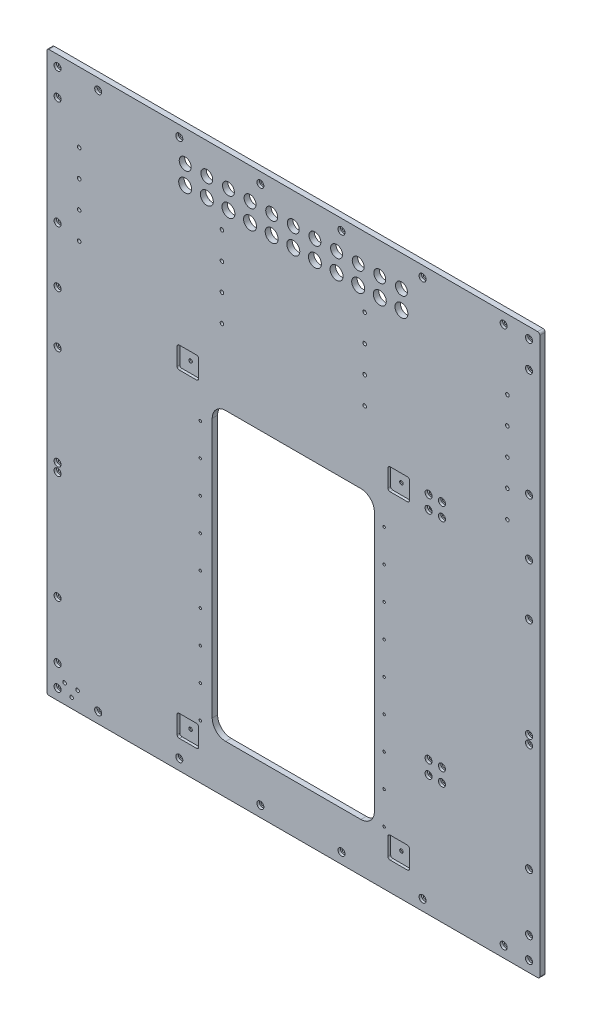
from build123d import *

# Parameters (mm, degrees)
BOSS_EXTRU_1_DEPTH                            = 10
ENL_V_MAT_EXTRU_1_DEPTH                       = 690.813199352
D_GAGEMENT_M41_D                              = 4.5
R_P_TITION_LIN_AIRE8_COUNT                    = 9
R_P_TITION_LIN_AIRE8_PITCH                    = 60
R_P_TITION_LIN_AIRE8_COUNT_DIR2               = 2
R_P_TITION_LIN_AIRE8_PITCH_DIR2               = 340
D_GAGEMENT_M65_D                              = 6.6
R_P_TITION_LIN_AIRE9_COUNT                    = 2
R_P_TITION_LIN_AIRE9_PITCH                    = 872
R_P_TITION_LIN_AIRE10_COUNT                   = 6
R_P_TITION_LIN_AIRE10_PITCH                   = 150
R_P_TITION_LIN_AIRE11_COUNT                   = 5
R_P_TITION_LIN_AIRE11_PITCH                   = 200
R_P_TITION_LIN_AIRE11_COUNT_DIR2              = 2
R_P_TITION_LIN_AIRE11_PITCH_DIR2              = 872
CHAMBRAGE_POUR_VIS_T_TE_RONDE_BOMB_4_A_COUNT  = 2
CHAMBRAGE_POUR_VIS_T_TE_RONDE_BOMB_4_A_PITCH  = 40
R_P_TITION_LIN_AIRE13_COUNT                   = 2
R_P_TITION_LIN_AIRE13_PITCH                   = 872
R_P_TITION_LIN_AIRE14_COUNT                   = 6
R_P_TITION_LIN_AIRE14_PITCH                   = 150
ESQUISSE41_R                                  = 1.5
ENL_V_MAT_EXTRU_2_DEPTH                       = 690.813199352
CHAMBRAGE_POUR_VIS_T_TE_RONDE_BOMB_6_A_COUNT  = 2
CHAMBRAGE_POUR_VIS_T_TE_RONDE_BOMB_6_A_PITCH  = 281
CHAMBRAGE_POUR_VIS_T_TE_RONDE_BOMB_7_COUNT    = 2
CHAMBRAGE_POUR_VIS_T_TE_RONDE_BOMB_7_PITCH    = 916.15773751
CHAMBRAGE_POUR_VIS_T_TE_RONDE_BOMB_8_COUNT    = 2
CHAMBRAGE_POUR_VIS_T_TE_RONDE_BOMB_8_PITCH    = 872
D_GAGEMENT_M67_D                              = 6.6
R_P_TITION_LIN_AIRE15_COUNT                   = 4
R_P_TITION_LIN_AIRE15_PITCH                   = 264
R_P_TITION_LIN_AIRE15_COUNT_DIR2              = 5
R_P_TITION_LIN_AIRE15_PITCH_DIR2              = 50
D_GAGEMENT_M68_D                              = 6.6
R_P_TITION_LIN_AIRE16_COUNT                   = 2
R_P_TITION_LIN_AIRE16_PITCH                   = 390
R_P_TITION_LIN_AIRE16_COUNT_DIR2              = 2
R_P_TITION_LIN_AIRE16_PITCH_DIR2              = 590
ENL_V_MAT_EXTRU_6_DEPTH                       = 5
R_P_TITION_LIN_AIRE18_COUNT                   = 2
R_P_TITION_LIN_AIRE18_PITCH                   = 590
R_P_TITION_LIN_AIRE18_COUNT_DIR2              = 2
R_P_TITION_LIN_AIRE18_PITCH_DIR2              = 390
ENL_V_MAT_EXTRU_9_DEPTH                       = 5
R_P_TITION_LIN_AIRE20_COUNT                   = 2
R_P_TITION_LIN_AIRE20_PITCH                   = 425
M6_CLEARANCE_HOLE1_D                          = 6.6
CBORE_FOR_M6_PAN_HEAD_MACHINE_SCREW2_AT_COUNT = 2
CBORE_FOR_M6_PAN_HEAD_MACHINE_SCREW2_AT_PITCH = 24.748737342
CBORE_FOR_M6_PAN_HEAD_MACHINE_SCREW2_2_COUNT  = 2
CBORE_FOR_M6_PAN_HEAD_MACHINE_SCREW2_2_PITCH  = 35
CBORE_FOR_M6_PAN_HEAD_MACHINE_SCREW2_3_COUNT  = 2
CBORE_FOR_M6_PAN_HEAD_MACHINE_SCREW2_3_PITCH  = 24.748737342
LPATTERN2_COUNT                               = 2
LPATTERN2_PITCH                               = 425
CBORE_FOR_M6_PAN_HEAD_MACHINE_SCREW3_AT_COUNT = 2
CBORE_FOR_M6_PAN_HEAD_MACHINE_SCREW3_AT_PITCH = 390
CBORE_FOR_M6_PAN_HEAD_MACHINE_SCREW3_2_COUNT  = 2
CBORE_FOR_M6_PAN_HEAD_MACHINE_SCREW3_2_PITCH  = 707.248188403
CBORE_FOR_M6_PAN_HEAD_MACHINE_SCREW3_3_COUNT  = 2
CBORE_FOR_M6_PAN_HEAD_MACHINE_SCREW3_3_PITCH  = 590
SKETCH11_R                                    = 3
CUT_EXTRUDE1_DEPTH                            = 10
M20_CLEARANCE_HOLE1_D                         = 22
M22_CLEARANCE_HOLE1_D                         = 24
LPATTERN3_COUNT                               = 6
LPATTERN3_PITCH                               = 40
LPATTERN4_COUNT                               = 6
LPATTERN4_PITCH                               = 40
M6_CLEARANCE_HOLE2_D                          = 6.6


with BuildPart() as part:
    # Esquisse1 → Boss.-Extru.1 (new body)
    with BuildSketch(Plane.XY):
        with BuildLine():
            Line((-452, -517.5), (452, -517.5))
            ThreePointArc((452, -517.5), (454.828427125, -516.328427125), (456, -513.5))
            Line((456, -513.5), (456, 513.5))
            ThreePointArc((456, 513.5), (454.828427125, 516.328427125), (452, 517.5))
            Line((452, 517.5), (-452, 517.5))
            ThreePointArc((-452, 517.5), (-454.828427125, 516.328427125), (-456, 513.5))
            Line((-456, 513.5), (-456, -513.5))
            ThreePointArc((-456, -513.5), (-454.828427125, -516.328427125), (-452, -517.5))
        make_face()
    extrude(amount=BOSS_EXTRU_1_DEPTH)

    # Esquisse2 → Enlèv. mat.-Extru.1 (cut, through all)
    with BuildSketch(Plane.XY.offset(10)):
        with BuildLine():
            Line((-125, -427.5), (125, -427.5))
            ThreePointArc((125, -427.5), (142.67766953, -420.17766953), (150, -402.5))
            Line((150, -402.5), (150, 77.5))
            ThreePointArc((150, 77.5), (142.67766953, 95.17766953), (125, 102.5))
            Line((125, 102.5), (-125, 102.5))
            ThreePointArc((-125, 102.5), (-142.67766953, 95.17766953), (-150, 77.5))
            Line((-150, 77.5), (-150, -402.5))
            ThreePointArc((-150, -402.5), (-142.67766953, -420.17766953), (-125, -427.5))
        make_face()
    extrude(amount=-ENL_V_MAT_EXTRU_1_DEPTH, mode=Mode.SUBTRACT)

    # Dégagement M41 (through all)
    with Locations(Plane.XY.offset(10)):
        with Locations((-172, -417.5)):
            d_gagement_m41 = Hole(D_GAGEMENT_M41_D / 2)

    # Répétition linéaire8: D_gagement M41 9 × 2
    with Locations(*[(j * R_P_TITION_LIN_AIRE8_PITCH_DIR2, i * R_P_TITION_LIN_AIRE8_PITCH, 0) for i in range(R_P_TITION_LIN_AIRE8_COUNT) for j in range(R_P_TITION_LIN_AIRE8_COUNT_DIR2) if (i, j) != (0, 0)]):
        add(d_gagement_m41, mode=Mode.SUBTRACT)

    # Dégagement M65 (through all)
    with Locations(Plane(origin=(0, 0, 0), x_dir=(-1, 0, 0), z_dir=(0, 0, -1))):
        with Locations((-436.000000001, 497.5), (-436.000000001, 448.286376646), (-389.123182304, 497.5), (-436.000000001, -457.5), (-436.000000001, -497.5), (-389.123182304, -497.5), (435.999999999, -457.5), (435.999999999, -497.5)):
            Hole(D_GAGEMENT_M65_D / 2)

    # Esquisse27 → Chambrage pour vis _ t_te ronde bomb_e M (revolve, cut)
    with BuildSketch(Plane(origin=(436.000000001, 497.5, 10), x_dir=(0, -1, 0), z_dir=(1, 0, 0))):
        Polygon((0, 0), (0, 10), (3.3, 10), (3.3, 4.625), (3.325, 4.6), (6.5, 4.6), (6.5, 0), align=None)
    chambrage_pour_vis_t_te_ronde_bomb_e_m = revolve(axis=Axis((436.000000001, 497.5, 16.35), (0, 0, -1)), mode=Mode.SUBTRACT)

    # Répétition linéaire9: Chambrage pour vis _ t_te ronde bomb_e M ×2
    with Locations(*[(-i * R_P_TITION_LIN_AIRE9_PITCH, 0, 0) for i in range(1, R_P_TITION_LIN_AIRE9_COUNT)]):
        add(chambrage_pour_vis_t_te_ronde_bomb_e_m, mode=Mode.SUBTRACT)

    # Esquisse29 → Chambrage pour vis _ t_te ronde bomb 2 (revolve, cut)
    with BuildSketch(Plane(origin=(389.123182304, 497.5, 10), x_dir=(0, -1, 0), z_dir=(1, 0, 0))):
        Polygon((0, 0), (0, 10), (3.3, 10), (3.3, 4.625), (3.325, 4.6), (6.5, 4.6), (6.5, 0), align=None)
    chambrage_pour_vis_t_te_ronde_bomb_2 = revolve(axis=Axis((389.123182304, 497.5, 16.35), (0, 0, -1)), mode=Mode.SUBTRACT)

    # Répétition linéaire10: Chambrage pour vis _ t_te ronde bomb 2 ×6
    with Locations(*[(-i * R_P_TITION_LIN_AIRE10_PITCH, 0, 0) for i in range(1, R_P_TITION_LIN_AIRE10_COUNT)]):
        add(chambrage_pour_vis_t_te_ronde_bomb_2, mode=Mode.SUBTRACT)

    # Esquisse31 → Chambrage pour vis _ t_te ronde bomb 3 (revolve, cut)
    with BuildSketch(Plane(origin=(436.000000001, 448.286376646, 10), x_dir=(0, -1, 0), z_dir=(1, 0, 0))):
        Polygon((0, 0), (0, 10), (3.3, 10), (3.3, 4.625), (3.325, 4.6), (6.5, 4.6), (6.5, 0), align=None)
    chambrage_pour_vis_t_te_ronde_bomb_3 = revolve(axis=Axis((436.000000001, 448.286376646, 16.35), (0, 0, -1)), mode=Mode.SUBTRACT)

    # Répétition linéaire11: Chambrage pour vis _ t_te ronde bomb 3 5 × 2
    with Locations(*[(-j * R_P_TITION_LIN_AIRE11_PITCH_DIR2, -i * R_P_TITION_LIN_AIRE11_PITCH, 0) for i in range(R_P_TITION_LIN_AIRE11_COUNT) for j in range(R_P_TITION_LIN_AIRE11_COUNT_DIR2) if (i, j) != (0, 0)]):
        add(chambrage_pour_vis_t_te_ronde_bomb_3, mode=Mode.SUBTRACT)

    # Esquisse33 → Chambrage pour vis _ t_te ronde bomb 4 (revolve, cut)
    with BuildSketch(Plane(origin=(436.000000001, -457.5, 10), x_dir=(0, -1, 0), z_dir=(1, 0, 0))):
        Polygon((0, 0), (0, 10), (3.3, 10), (3.3, 4.625), (3.325, 4.6), (6.5, 4.6), (6.5, 0), align=None)
    chambrage_pour_vis_t_te_ronde_bomb_4 = revolve(axis=Axis((436.000000001, -457.5, 16.35), (0, 0, -1)), mode=Mode.SUBTRACT)

    # Chambrage pour vis _ t_te ronde bomb 4 a: Chambrage pour vis _ t_te ronde bomb 4 ×2
    with Locations(*[(0, -i * CHAMBRAGE_POUR_VIS_T_TE_RONDE_BOMB_4_A_PITCH, 0) for i in range(1, CHAMBRAGE_POUR_VIS_T_TE_RONDE_BOMB_4_A_COUNT)]):
        add(chambrage_pour_vis_t_te_ronde_bomb_4, mode=Mode.SUBTRACT)

    # Répétition linéaire13: Chambrage pour vis _ t_te ronde bomb 4 ×2
    with Locations(*[(-i * R_P_TITION_LIN_AIRE13_PITCH, 0, 0) for i in range(1, R_P_TITION_LIN_AIRE13_COUNT)]):
        add(chambrage_pour_vis_t_te_ronde_bomb_4, mode=Mode.SUBTRACT)

    # Répétition linéaire13 copy 1 sketch → Répétition linéaire13 copy 1 (revolve, cut)
    with BuildSketch(Plane(origin=(-435.999999999, -497.5, 10), x_dir=(0, -1, 0), z_dir=(1, 0, 0))):
        Polygon((0, 0), (0, 10), (3.3, 10), (3.3, 4.625), (3.325, 4.6), (6.5, 4.6), (6.5, 0), align=None)
    revolve(axis=Axis((-435.999999999, -497.5, 16.35), (0, 0, -1)), mode=Mode.SUBTRACT)

    # Esquisse35 → Chambrage pour vis _ t_te ronde bomb 5 (revolve, cut)
    with BuildSketch(Plane(origin=(389.123182304, -497.5, 10), x_dir=(0, -1, 0), z_dir=(1, 0, 0))):
        Polygon((0, 0), (0, 10), (3.3, 10), (3.3, 4.625), (3.325, 4.6), (6.5, 4.6), (6.5, 0), align=None)
    chambrage_pour_vis_t_te_ronde_bomb_5 = revolve(axis=Axis((389.123182304, -497.5, 16.35), (0, 0, -1)), mode=Mode.SUBTRACT)

    # Répétition linéaire14: Chambrage pour vis _ t_te ronde bomb 5 ×6
    with Locations(*[(-i * R_P_TITION_LIN_AIRE14_PITCH, 0, 0) for i in range(1, R_P_TITION_LIN_AIRE14_COUNT)]):
        add(chambrage_pour_vis_t_te_ronde_bomb_5, mode=Mode.SUBTRACT)

    # Esquisse41 → Enlèv. mat.-Extru.2 (cut, through all)
    with BuildSketch(Plane.XY.offset(10)):
        with Locations((-436, 144.5)):
            Circle(ESQUISSE41_R)
        with Locations((-436, -136.5)):
            Circle(ESQUISSE41_R)
    enl_v_mat_extru_2 = extrude(amount=-ENL_V_MAT_EXTRU_2_DEPTH, mode=Mode.SUBTRACT)

    # Symétrie1: Enlèv. mat.-Extru.2 across plane
    add(enl_v_mat_extru_2.mirror(Plane(origin=(0, 0, 0), x_dir=(0, 0, 1), z_dir=(1, 0, 0))), mode=Mode.SUBTRACT)

    # Esquisse44 → Chambrage pour vis _ t_te ronde bomb 6 (revolve, cut)
    with BuildSketch(Plane(origin=(-436, 144.5, 10), x_dir=(0, -1, 0), z_dir=(1, 0, 0))):
        Polygon((0, 0), (0, 10), (3.3, 10), (3.3, 4.625), (3.325, 4.6), (6.5, 4.6), (6.5, 0), align=None)
    chambrage_pour_vis_t_te_ronde_bomb_6 = revolve(axis=Axis((-436, 144.5, 16.35), (0, 0, -1)), mode=Mode.SUBTRACT)

    # Chambrage pour vis _ t_te ronde bomb 6 a: Chambrage pour vis _ t_te ronde bomb 6 ×2
    with Locations(*[(0, -i * CHAMBRAGE_POUR_VIS_T_TE_RONDE_BOMB_6_A_PITCH, 0) for i in range(1, CHAMBRAGE_POUR_VIS_T_TE_RONDE_BOMB_6_A_COUNT)]):
        add(chambrage_pour_vis_t_te_ronde_bomb_6, mode=Mode.SUBTRACT)

    # Chambrage pour vis _ t_te ronde bomb 7: Chambrage pour vis _ t_te ronde bomb 6 ×2
    with Locations(*[Vector(0.9518011629413234, -0.306715741727653, 0) * (i * CHAMBRAGE_POUR_VIS_T_TE_RONDE_BOMB_7_PITCH) for i in range(1, CHAMBRAGE_POUR_VIS_T_TE_RONDE_BOMB_7_COUNT)]):
        add(chambrage_pour_vis_t_te_ronde_bomb_6, mode=Mode.SUBTRACT)

    # Chambrage pour vis _ t_te ronde bomb 8: Chambrage pour vis _ t_te ronde bomb 6 ×2
    with Locations(*[(i * CHAMBRAGE_POUR_VIS_T_TE_RONDE_BOMB_8_PITCH, 0, 0) for i in range(1, CHAMBRAGE_POUR_VIS_T_TE_RONDE_BOMB_8_COUNT)]):
        add(chambrage_pour_vis_t_te_ronde_bomb_6, mode=Mode.SUBTRACT)

    # Dégagement M67 (through all)
    with Locations(Plane(origin=(0, 0, 0), x_dir=(-1, 0, 0), z_dir=(0, 0, -1))):
        with Locations((-396.00143494, 188.397832099)):
            d_gagement_m67 = Hole(D_GAGEMENT_M67_D / 2)

    # Répétition linéaire15: D_gagement M67 4 × 5, 3 skipped
    with Locations(*[(-i * R_P_TITION_LIN_AIRE15_PITCH, j * R_P_TITION_LIN_AIRE15_PITCH_DIR2, 0) for i in range(R_P_TITION_LIN_AIRE15_COUNT) for j in range(R_P_TITION_LIN_AIRE15_COUNT_DIR2) if (i, j) not in ((0, 0), (1, 0), (2, 0), (3, 0))]):
        add(d_gagement_m67, mode=Mode.SUBTRACT)

    # Dégagement M68 (through all)
    with Locations(Plane(origin=(0, 0, 0), x_dir=(-1, 0, 0), z_dir=(0, 0, -1))):
        with Locations((-195, 144.5)):
            Hole(D_GAGEMENT_M68_D / 2)

    # Esquisse49 → Chambrage pour vis _ t_te ronde bomb 9 (revolve, cut)
    with BuildSketch(Plane(origin=(195, 144.5, 10), x_dir=(0, -1, 0), z_dir=(1, 0, 0))):
        Polygon((0, 0), (0, 10), (2.25, 10), (2.25, 3.125), (2.275, 3.1), (4.5, 3.1), (4.5, 0), align=None)
    chambrage_pour_vis_t_te_ronde_bomb_9 = revolve(axis=Axis((195, 144.5, 16.35), (0, 0, -1)), mode=Mode.SUBTRACT)

    # Répétition linéaire16: Chambrage pour vis _ t_te ronde bomb 9 2 × 2
    with Locations(*[(-i * R_P_TITION_LIN_AIRE16_PITCH, -j * R_P_TITION_LIN_AIRE16_PITCH_DIR2, 0) for i in range(R_P_TITION_LIN_AIRE16_COUNT) for j in range(R_P_TITION_LIN_AIRE16_COUNT_DIR2) if (i, j) != (0, 0)]):
        add(chambrage_pour_vis_t_te_ronde_bomb_9, mode=Mode.SUBTRACT)

    # Esquisse52 → Enlèv. mat.-Extru.6 (cut)
    with BuildSketch(Plane(origin=(0, 0, 10), x_dir=(-1, 0, 0), z_dir=(0, 0, -1))):
        with BuildLine():
            Line((-211, -425.5), (-179, -425.5))
            add(Edge.make_bspline(
                [(-179, -425.5), (-175.343145751, -425.843145751), (-175, -429.5)],
                knots=[0, 0, 0, 1, 1, 1], degree=2))
            Line((-175, -429.5), (-175, -461.5))
            add(Edge.make_bspline(
                [(-175, -461.5), (-175.343145751, -465.156854249), (-179, -465.5)],
                knots=[0, 0, 0, 1, 1, 1], degree=2))
            Line((-179, -465.5), (-211, -465.5))
            add(Edge.make_bspline(
                [(-211, -465.5), (-214.656854249, -465.156854249), (-215, -461.5)],
                knots=[0, 0, 0, 1, 1, 1], degree=2))
            Line((-215, -461.5), (-215, -429.5))
            add(Edge.make_bspline(
                [(-215, -429.5), (-214.656854249, -425.843145751), (-211, -425.5)],
                knots=[0, 0, 0, 1, 1, 1], degree=2))
        make_face()
    enl_v_mat_extru_6 = extrude(amount=ENL_V_MAT_EXTRU_6_DEPTH, mode=Mode.SUBTRACT)

    # Répétition linéaire18: Enl_v. mat.-Extru.6 2 × 2
    with Locations(*[(-j * R_P_TITION_LIN_AIRE18_PITCH_DIR2, i * R_P_TITION_LIN_AIRE18_PITCH, 0) for i in range(R_P_TITION_LIN_AIRE18_COUNT) for j in range(R_P_TITION_LIN_AIRE18_COUNT_DIR2) if (i, j) != (0, 0)]):
        add(enl_v_mat_extru_6, mode=Mode.SUBTRACT)

    # Esquisse51 → Enlèv. mat.-Extru.9 (cut)
    with BuildSketch(Plane.XY):
        with BuildLine():
            Line((246.576088012, 163.539500972), (278.576088012, 163.539500972))
            add(Edge.make_bspline(
                [(278.576088012, 163.539500972), (282.232942261, 163.196355221), (282.576088012, 159.539500972)],
                knots=[0, 0, 0, 1, 1, 1], degree=2))
            add(Edge.make_bspline(
                [(282.576088012, 159.539500972), (282.576088012, 144.511124743), (282.576088012, 127.539500972)],
                knots=[0, 0, 0, 1, 1, 1], degree=2))
            add(Edge.make_bspline(
                [(282.576088012, 127.539500972), (282.232942261, 123.882646722), (278.576088012, 123.539500972)],
                knots=[0, 0, 0, 1, 1, 1], degree=2))
            Line((278.576088012, 123.539500972), (246.576088012, 123.539500972))
            add(Edge.make_bspline(
                [(246.576088012, 123.539500972), (242.919233762, 123.882646722), (242.576088012, 127.539500972)],
                knots=[0, 0, 0, 1, 1, 1], degree=2))
            Line((242.576088012, 127.539500972), (242.576088012, 159.539500972))
            add(Edge.make_bspline(
                [(242.576088012, 159.539500972), (242.919233762, 163.196355221), (246.576088012, 163.539500972)],
                knots=[0, 0, 0, 1, 1, 1], degree=2))
        make_face()
    enl_v_mat_extru_9 = extrude(amount=ENL_V_MAT_EXTRU_9_DEPTH, mode=Mode.SUBTRACT)

    # Répétition linéaire20: Enlèv. mat.-Extru.9 ×2
    with Locations(*[(0, -i * R_P_TITION_LIN_AIRE20_PITCH, 0) for i in range(1, R_P_TITION_LIN_AIRE20_COUNT)]):
        add(enl_v_mat_extru_9, mode=Mode.SUBTRACT)

    # M6 Clearance Hole1 (through all)
    with Locations(Plane(origin=(0, 0, 5), x_dir=(-1, 0, 0), z_dir=(0, 0, -1))):
        with Locations((-274.950456682, 155.913869643), (-250.201719341, 155.913869643), (-250.201719341, 131.165132301), (-274.950456682, 131.165132301)):
            Hole(M6_CLEARANCE_HOLE1_D / 2)

    # Sketch7 → CBORE for M6 Pan Head Machine Screw2 (revolve, cut)
    with BuildSketch(Plane(origin=(274.950456682, 155.913869643, 10), x_dir=(0, -1, 0), z_dir=(1, 0, 0))):
        Polygon((0, 0), (0, 10), (3.3, 10), (3.3, 4.625), (3.325, 4.6), (6.5, 4.6), (6.5, 0), align=None)
    cbore_for_m6_pan_head_machine_screw2 = revolve(axis=Axis((274.950456682, 155.913869643, 16.35), (0, 0, -1)), mode=Mode.SUBTRACT)

    # CBORE for M6 Pan Head Machine Screw2 at: CBORE for M6 Pan Head Machine Screw2 ×2
    with Locations(*[(-i * CBORE_FOR_M6_PAN_HEAD_MACHINE_SCREW2_AT_PITCH, 0, 0) for i in range(1, CBORE_FOR_M6_PAN_HEAD_MACHINE_SCREW2_AT_COUNT)]):
        add(cbore_for_m6_pan_head_machine_screw2, mode=Mode.SUBTRACT)

    # CBORE for M6 Pan Head Machine Screw2 2: CBORE for M6 Pan Head Machine Screw2 ×2
    with Locations(*[Vector(-0.7071067811865277, -0.7071067811865674, 0) * (i * CBORE_FOR_M6_PAN_HEAD_MACHINE_SCREW2_2_PITCH) for i in range(1, CBORE_FOR_M6_PAN_HEAD_MACHINE_SCREW2_2_COUNT)]):
        add(cbore_for_m6_pan_head_machine_screw2, mode=Mode.SUBTRACT)

    # CBORE for M6 Pan Head Machine Screw2 3: CBORE for M6 Pan Head Machine Screw2 ×2
    with Locations(*[(0, -i * CBORE_FOR_M6_PAN_HEAD_MACHINE_SCREW2_3_PITCH, 0) for i in range(1, CBORE_FOR_M6_PAN_HEAD_MACHINE_SCREW2_3_COUNT)]):
        add(cbore_for_m6_pan_head_machine_screw2, mode=Mode.SUBTRACT)

    # LPattern2: CBORE for M6 Pan Head Machine Screw2 ×2
    with Locations(*[(0, -i * LPATTERN2_PITCH, 0) for i in range(1, LPATTERN2_COUNT)]):
        add(cbore_for_m6_pan_head_machine_screw2, mode=Mode.SUBTRACT)

    # LPattern2 copy 1 sketch → LPattern2 copy 1 (revolve, cut)
    with BuildSketch(Plane(origin=(250.201719341, -269.086130357, 10), x_dir=(0, -1, 0), z_dir=(1, 0, 0))):
        Polygon((0, 0), (0, 10), (3.3, 10), (3.3, 4.625), (3.325, 4.6), (6.5, 4.6), (6.5, 0), align=None)
    revolve(axis=Axis((250.201719341, -269.086130357, 16.35), (0, 0, -1)), mode=Mode.SUBTRACT)

    # LPattern2 copy 2 sketch → LPattern2 copy 2 (revolve, cut)
    with BuildSketch(Plane(origin=(250.201719341, -293.834867699, 10), x_dir=(0, -1, 0), z_dir=(1, 0, 0))):
        Polygon((0, 0), (0, 10), (3.3, 10), (3.3, 4.625), (3.325, 4.6), (6.5, 4.6), (6.5, 0), align=None)
    revolve(axis=Axis((250.201719341, -293.834867699, 16.35), (0, 0, -1)), mode=Mode.SUBTRACT)

    # LPattern2 copy 3 sketch → LPattern2 copy 3 (revolve, cut)
    with BuildSketch(Plane(origin=(274.950456682, -293.834867699, 10), x_dir=(0, -1, 0), z_dir=(1, 0, 0))):
        Polygon((0, 0), (0, 10), (3.3, 10), (3.3, 4.625), (3.325, 4.6), (6.5, 4.6), (6.5, 0), align=None)
    revolve(axis=Axis((274.950456682, -293.834867699, 16.35), (0, 0, -1)), mode=Mode.SUBTRACT)

    # Sketch9 → CBORE for M6 Pan Head Machine Screw3 (revolve, cut)
    with BuildSketch(Plane(origin=(195, 144.5, 0), x_dir=(0, 1, 0), z_dir=(1, 0, 0))):
        Polygon((0, 0), (0, 10), (3.3, 10), (3.3, 4.625), (3.325, 4.6), (6.5, 4.6), (6.5, 0), align=None)
    cbore_for_m6_pan_head_machine_screw3 = revolve(axis=Axis((195, 144.5, -6.35), (0, 0, 1)), mode=Mode.SUBTRACT)

    # CBORE for M6 Pan Head Machine Screw3 at: CBORE for M6 Pan Head Machine Screw3 ×2
    with Locations(*[(-i * CBORE_FOR_M6_PAN_HEAD_MACHINE_SCREW3_AT_PITCH, 0, 0) for i in range(1, CBORE_FOR_M6_PAN_HEAD_MACHINE_SCREW3_AT_COUNT)]):
        add(cbore_for_m6_pan_head_machine_screw3, mode=Mode.SUBTRACT)

    # CBORE for M6 Pan Head Machine Screw3 2: CBORE for M6 Pan Head Machine Screw3 ×2
    with Locations(*[Vector(-0.5514330137492124, -0.8342191746462442, 0) * (i * CBORE_FOR_M6_PAN_HEAD_MACHINE_SCREW3_2_PITCH) for i in range(1, CBORE_FOR_M6_PAN_HEAD_MACHINE_SCREW3_2_COUNT)]):
        add(cbore_for_m6_pan_head_machine_screw3, mode=Mode.SUBTRACT)

    # CBORE for M6 Pan Head Machine Screw3 3: CBORE for M6 Pan Head Machine Screw3 ×2
    with Locations(*[(0, -i * CBORE_FOR_M6_PAN_HEAD_MACHINE_SCREW3_3_PITCH, 0) for i in range(1, CBORE_FOR_M6_PAN_HEAD_MACHINE_SCREW3_3_COUNT)]):
        add(cbore_for_m6_pan_head_machine_screw3, mode=Mode.SUBTRACT)

    # Sketch11 → Cut-Extrude1 (cut)
    with BuildSketch(Plane(origin=(0, 0, 0), x_dir=(-1, 0, 0), z_dir=(0, 0, -1))):
        with Locations((0, 460.224458025)):
            Circle(SKETCH11_R)
        with Locations((0, 425.673374074)):
            Circle(SKETCH11_R)
    extrude(amount=-CUT_EXTRUDE1_DEPTH, mode=Mode.SUBTRACT)

    # M20 Clearance Hole1 (through all)
    with Locations(Plane(origin=(0, 0, 0), x_dir=(-1, 0, 0), z_dir=(0, 0, -1))):
        with Locations((0, 460.224458025)):
            m20_clearance_hole1 = Hole(M20_CLEARANCE_HOLE1_D / 2)

    # M22 Clearance Hole1 (through all)
    with Locations(Plane(origin=(0, 0, 0), x_dir=(-1, 0, 0), z_dir=(0, 0, -1))):
        with Locations((0, 425.673374074)):
            m22_clearance_hole1 = Hole(M22_CLEARANCE_HOLE1_D / 2)

    # LPattern3: M20 Clearance Hole1, M22 Clearance Hole1 ×6
    with Locations(*[(i * LPATTERN3_PITCH, 0, 0) for i in range(1, LPATTERN3_COUNT)]):
        add(m20_clearance_hole1, mode=Mode.SUBTRACT)
        add(m22_clearance_hole1, mode=Mode.SUBTRACT)

    # LPattern4: M20 Clearance Hole1, M22 Clearance Hole1 ×6
    with Locations(*[(-i * LPATTERN4_PITCH, 0, 0) for i in range(1, LPATTERN4_COUNT)]):
        add(m20_clearance_hole1, mode=Mode.SUBTRACT)
        add(m22_clearance_hole1, mode=Mode.SUBTRACT)

    # M6 Clearance Hole2 (through all)
    with Locations(Plane.XY.offset(10)):
        with Locations((-410, -499.5), (-399, -482.654351988), (-423, -482.654351988)):
            Hole(M6_CLEARANCE_HOLE2_D / 2)


solid = part.part
